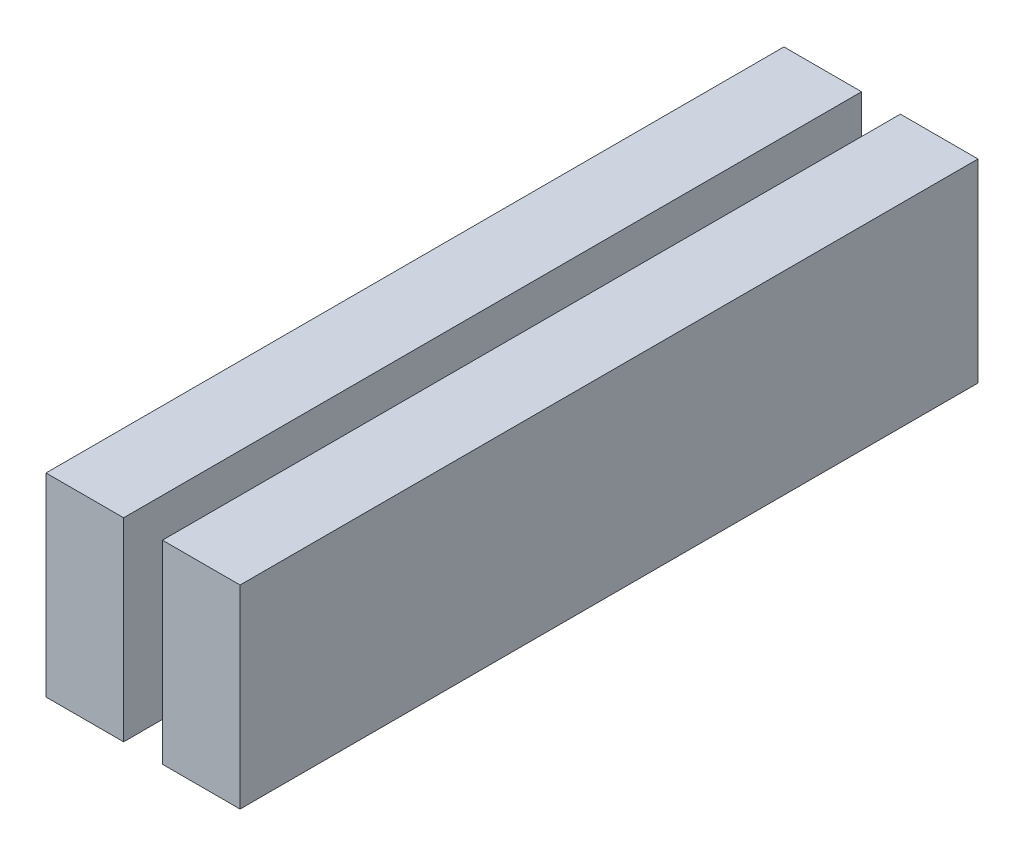
from build123d import *

# Parameters (mm, degrees)
SKETCH_1_W        = 789
SKETCH_1_H        = 789
EXTRUDE_252_DEPTH = 3000
OTHER_START       = 315.6
OTHER_1_OUTLINE_W = 789
OTHER_1_OUTLINE_H = 3000
OTHER_1_DEPTH     = 157.8


# Read off the part's stored shape, not the designer's step: Полость1
with BuildPart() as part:
    # Эскиз1 → Extrude 252 (new body)
    with BuildSketch(Plane.XY):
        with Locations((394.5, 394.5)):
            Rectangle(SKETCH_1_W, SKETCH_1_H)
    extrude(amount=-EXTRUDE_252_DEPTH)

    # Полость1 outline → Полость1 (cut)
    with BuildSketch(Plane.YZ.offset(OTHER_START)):
        with Locations((394.5, -1500)):
            Rectangle(OTHER_1_OUTLINE_W, OTHER_1_OUTLINE_H)
    extrude(amount=OTHER_1_DEPTH, mode=Mode.SUBTRACT)


solid = part.part
